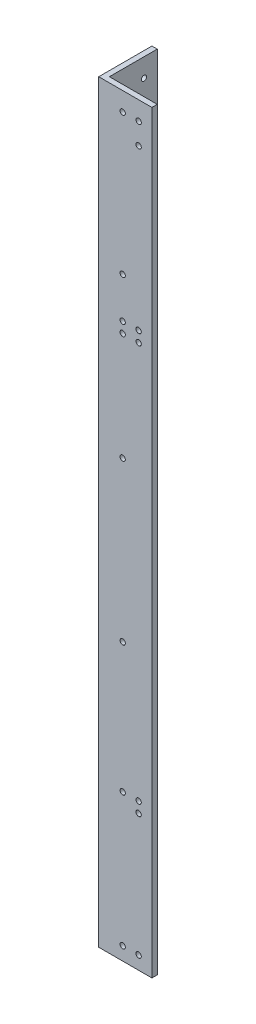
from build123d import *

# Parameters (mm, degrees)
BOSS_EXTRUDE1_DEPTH               = 450
BACKSIDEHOLES_SKETCH3_R           = 1.5875
BACKSIDEHOLES_CUT_EXTRUDE1_DEPTH  = 3.175
RIGHTSIDEHOLES_SKETCH4_R          = 1.5875
RIGHTSIDEHOLES_CUT_EXTRUDE2_DEPTH = 3.175


with BuildPart() as part:
    # Sketch2 → Boss-Extrude1 (new body)
    with BuildSketch(Plane(origin=(0, 0, 0), x_dir=(1, 0, 0), z_dir=(0, 1, 0))):
        Polygon((0, 31.75), (3.175, 31.75), (3.175, 3.175), (31.75, 3.175), (31.75, 0), (0, 0), align=None)
    extrude(amount=BOSS_EXTRUDE1_DEPTH)

    # BackSideHoles-Sketch3 → BackSideHoles-Cut-Extrude1 (cut)
    with BuildSketch(Plane.XY):
        with Locations((23.8125, 81.1125)):
            Circle(BACKSIDEHOLES_SKETCH3_R)
        with Locations((14.2875, 87.4625)):
            Circle(BACKSIDEHOLES_SKETCH3_R)
        with Locations((23.8125, 87.4625)):
            Circle(BACKSIDEHOLES_SKETCH3_R)
        with Locations((14.2875, 438.8875)):
            Circle(BACKSIDEHOLES_SKETCH3_R)
        with Locations((23.8125, 438.8875)):
            Circle(BACKSIDEHOLES_SKETCH3_R)
        with Locations((23.8125, 426.1875)):
            Circle(BACKSIDEHOLES_SKETCH3_R)
        with Locations((14.2875, 330.777644)):
            Circle(BACKSIDEHOLES_SKETCH3_R)
        with Locations((23.8125, 330.777644)):
            Circle(BACKSIDEHOLES_SKETCH3_R)
        with Locations((14.2875, 324.427644)):
            Circle(BACKSIDEHOLES_SKETCH3_R)
        with Locations((23.8125, 324.427644)):
            Circle(BACKSIDEHOLES_SKETCH3_R)
        with Locations((14.2875, 165)):
            Circle(BACKSIDEHOLES_SKETCH3_R)
        with Locations((14.2875, 260)):
            Circle(BACKSIDEHOLES_SKETCH3_R)
        with Locations((14.2875, 7.9375)):
            Circle(BACKSIDEHOLES_SKETCH3_R)
        with Locations((23.8125, 7.9375)):
            Circle(BACKSIDEHOLES_SKETCH3_R)
        with Locations((14.2875, 355)):
            Circle(BACKSIDEHOLES_SKETCH3_R)
    extrude(amount=-BACKSIDEHOLES_CUT_EXTRUDE1_DEPTH, mode=Mode.SUBTRACT)

    # RightSideHoles-Sketch4 → RightSideHoles-Cut-Extrude2 (cut)
    with BuildSketch(Plane.ZY):
        with Locations((-23.8125, 81.1125)):
            Circle(RIGHTSIDEHOLES_SKETCH4_R)
        with Locations((-23.8125, 87.4625)):
            Circle(RIGHTSIDEHOLES_SKETCH4_R)
        with Locations((-23.8125, 438.8875)):
            Circle(RIGHTSIDEHOLES_SKETCH4_R)
        with Locations((-14.2875, 426.1875)):
            Circle(RIGHTSIDEHOLES_SKETCH4_R)
        with Locations((-23.8125, 426.1875)):
            Circle(RIGHTSIDEHOLES_SKETCH4_R)
        with Locations((-23.8125, 332.377644)):
            Circle(RIGHTSIDEHOLES_SKETCH4_R)
        with Locations((-14.2875, 332.377644)):
            Circle(RIGHTSIDEHOLES_SKETCH4_R)
        with Locations((-23.8125, 297.452644)):
            Circle(RIGHTSIDEHOLES_SKETCH4_R)
        with Locations((-14.2875, 297.452644)):
            Circle(RIGHTSIDEHOLES_SKETCH4_R)
        with Locations((-23.8125, 7.9375)):
            Circle(RIGHTSIDEHOLES_SKETCH4_R)
        with Locations((-14.2875, 7.9375)):
            Circle(RIGHTSIDEHOLES_SKETCH4_R)
        with Locations((-14.2875, 165)):
            Circle(RIGHTSIDEHOLES_SKETCH4_R)
        with Locations((-14.2875, 260)):
            Circle(RIGHTSIDEHOLES_SKETCH4_R)
        with Locations((-14.2875, 81.1125)):
            Circle(RIGHTSIDEHOLES_SKETCH4_R)
        with Locations((-14.2875, 355)):
            Circle(RIGHTSIDEHOLES_SKETCH4_R)
    extrude(amount=-RIGHTSIDEHOLES_CUT_EXTRUDE2_DEPTH, mode=Mode.SUBTRACT)


solid = part.part
